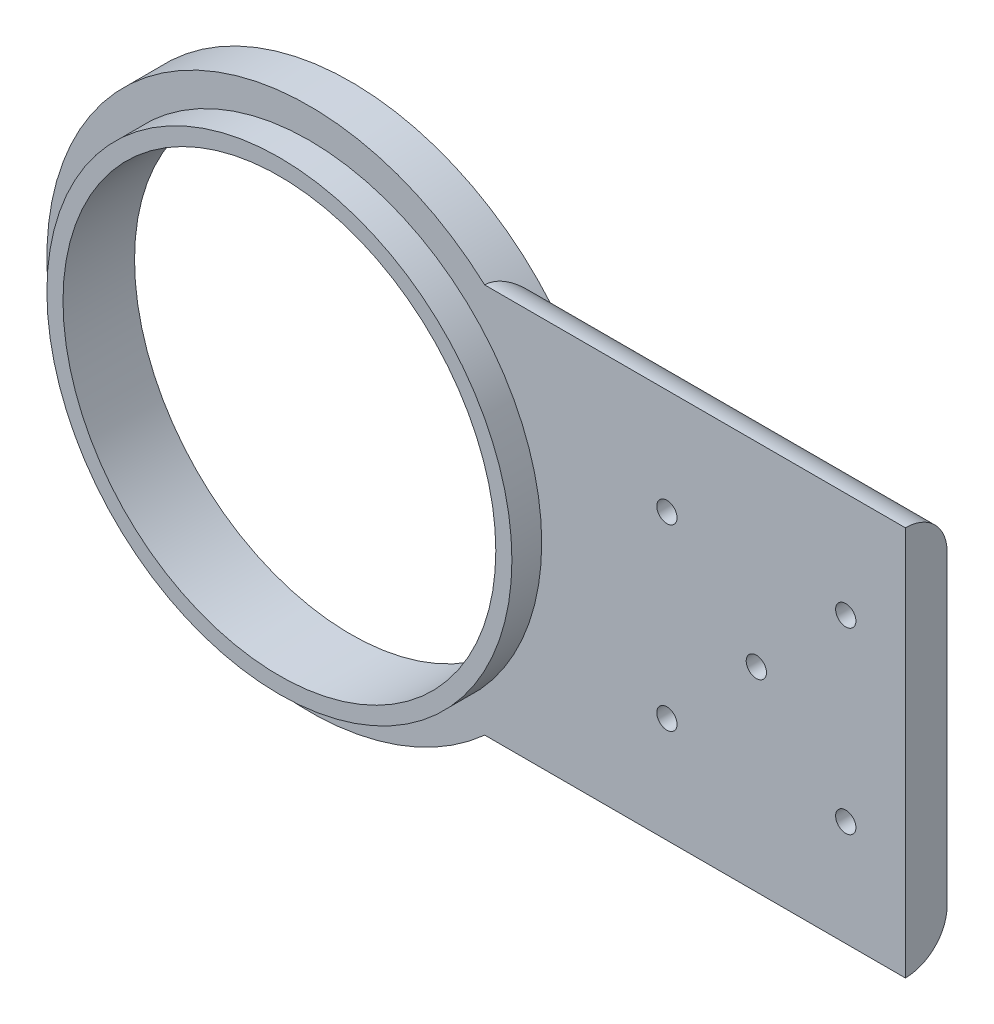
from build123d import *
from build123d.topology import SkipClean

# Parameters (mm, degrees)
CROQUIS1_R                                           = 39
CROQUIS1_R_2                                         = 36.3
SALIENTE_EXTRUIR1_DEPTH                              = 2.5
SALIENTE_EXTRUIR2_START                              = 7
CROQUIS2_R                                           = 44
CROQUIS2_R_2                                         = 36.3
SALIENTE_EXTRUIR2_DEPTH                              = 7
SALIENTE_EXTRUIR3_DEPTH                              = 7
REDONDEO1_R                                          = 7
REFRENTADO_PARA_TORNILLO_CON_CABEZA_TRON_D           = 3.4
REFRENTADO_PARA_TORNILLO_CON_CABEZA_TRON_CBORE_D     = 7
REFRENTADO_PARA_TORNILLO_CON_CABEZA_TRON_CBORE_DEPTH = 2.4


with BuildPart() as part:
    # Croquis1 → Saliente-Extruir1 (new, symmetric)
    with BuildSketch(Plane.XY):
        Circle(CROQUIS1_R)
        Circle(CROQUIS1_R_2, mode=Mode.SUBTRACT)
    extrude(amount=SALIENTE_EXTRUIR1_DEPTH, both=True)

    # Croquis2 → Saliente-Extruir2 (add)
    with SkipClean():  # the faces are left unmerged after this step: merging them gives an invalid solid
        with BuildSketch(Plane(origin=(0, 0, -2.5), x_dir=(-1, 0, 0), z_dir=(0, 0, -1)).offset(SALIENTE_EXTRUIR2_START)):
            Circle(CROQUIS2_R)
            Circle(CROQUIS2_R_2, mode=Mode.SUBTRACT)
        extrude(amount=-SALIENTE_EXTRUIR2_DEPTH)

    # Croquis3 → Saliente-Extruir3 (add)
    with SkipClean():  # the faces are left unmerged after this step: merging them gives an invalid solid
        with BuildSketch(Plane(origin=(0, 0, -9.5), x_dir=(-1, 0, 0), z_dir=(0, 0, -1))):
            with BuildLine():
                ThreePointArc((-29.439938859, -32.7), (-44, 0), (-29.439938859, 32.7))
                Line((-29.439938859, 32.7), (-100, 32.7))
                Line((-100, 32.7), (-100, -32.7))
                Line((-100, -32.7), (-29.439938859, -32.7))
            make_face()
        extrude(amount=-SALIENTE_EXTRUIR3_DEPTH)

    # Redondeo1
    # the kernel refuses this fillet: 7 mm, written as the material it takes off along each edge
    with BuildSketch(Plane(origin=(117.5, -32.7, -9.5), x_dir=(0, 0, 1), z_dir=(-1, 0, 0))) as redondeo1_piece_1_section:
        with BuildLine():
            CenterArc((REDONDEO1_R, REDONDEO1_R), REDONDEO1_R, 180, 90)
            Line((0, REDONDEO1_R), (0, 0))
            Line((0, 0), (REDONDEO1_R, 0))
        make_face()
    redondeo1_piece_1 = extrude(amount=105.560061141, mode=Mode.PRIVATE)
    redondeo1_piece_1 = redondeo1_piece_1 - Plane(origin=(0, 0, -7.900053472), x_dir=(-1, 0, 0), z_dir=(0, 0, -1)) * Cylinder(44, 240, mode=Mode.PRIVATE)
    add(redondeo1_piece_1, mode=Mode.SUBTRACT)
    with BuildSketch(Plane(origin=(11.939938859, 32.7, -9.5), x_dir=(0, 0, 1), z_dir=(1, 0, 0))) as redondeo1_piece_2_section:
        with BuildLine():
            CenterArc((REDONDEO1_R, REDONDEO1_R), REDONDEO1_R, 180, 90)
            Line((0, REDONDEO1_R), (0, 0))
            Line((0, 0), (REDONDEO1_R, 0))
        make_face()
    redondeo1_piece_2 = extrude(amount=105.560061141, mode=Mode.PRIVATE)
    redondeo1_piece_2 = redondeo1_piece_2 - Plane(origin=(0, 0, -7.900055763), x_dir=(-1, 0, 0), z_dir=(0, 0, -1)) * Cylinder(44, 240, mode=Mode.PRIVATE)
    add(redondeo1_piece_2, mode=Mode.SUBTRACT)

    # Refrentado para tornillo con cabeza troncocónica de M31 (through all)
    with Locations(Plane(origin=(0, 0, -9.5), x_dir=(-1, 0, 0), z_dir=(0, 0, -1))):
        with Locations((-75, 0), (-90, 15), (-60, -15), (-60, 15), (-90, -15)):
            CounterBoreHole(REFRENTADO_PARA_TORNILLO_CON_CABEZA_TRON_D / 2, REFRENTADO_PARA_TORNILLO_CON_CABEZA_TRON_CBORE_D / 2, REFRENTADO_PARA_TORNILLO_CON_CABEZA_TRON_CBORE_DEPTH)


solid = part.part
